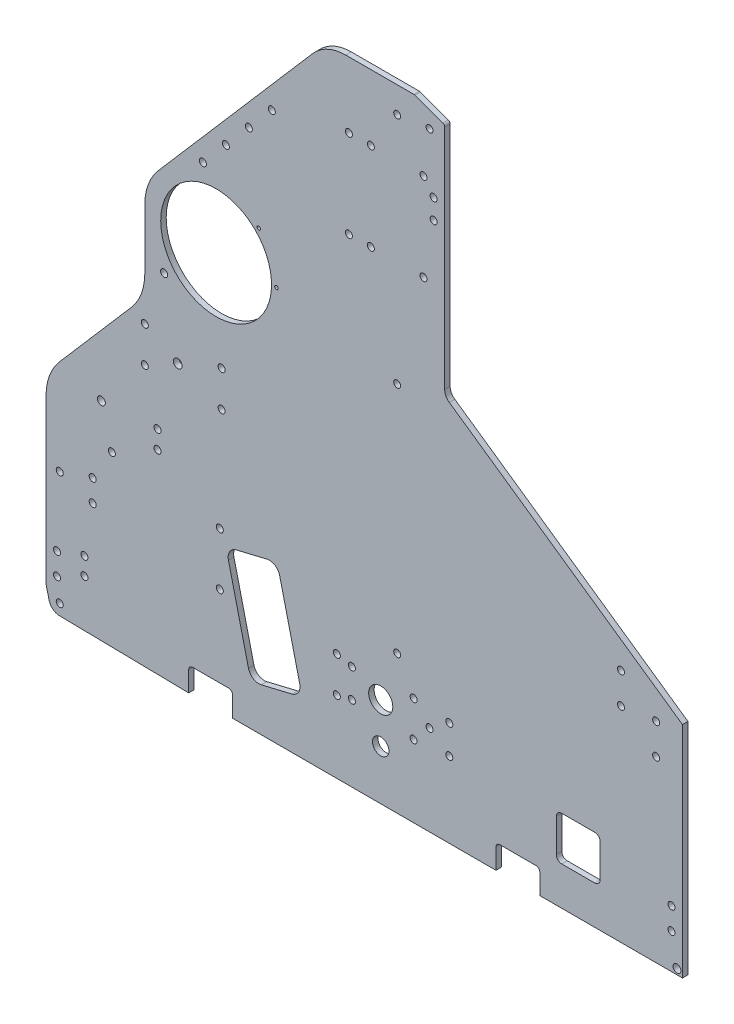
from build123d import *

# Parameters (mm, degrees)
SKETCH1_R           = 2.032
SKETCH1_R_2         = 2.54
SKETCH1_R_3         = 2
BOSS_EXTRUDE1_DEPTH = 3.175
FILLET1_R           = 2.286
FILLET2_R           = 6.35
SKETCH2_R           = 2.032
CUT_EXTRUDE1_DEPTH  = 505.524983177
FILLET3_R           = 1.5875
SKETCH3_R           = 2.032
SKETCH3_R_2         = 2.286
SKETCH3_R_3         = 1.016
CUT_EXTRUDE2_DEPTH  = 505.524983177
SKETCH4_R           = 2.032
SKETCH4_R_2         = 6.985
SKETCH4_R_3         = 4.7625
CUT_EXTRUDE3_DEPTH  = 505.524983177
SKETCH5_R           = 32.0675
SKETCH5_R_2         = 2.286000001
CUT_EXTRUDE5_DEPTH  = 540.282512256
FILLET4_R           = 31.75
CUT_EXTRUDE6_DEPTH  = 505.524983177
FILLET5_R           = 25.4
SKETCH8_R           = 2.032
CUT_EXTRUDE7_DEPTH  = 505.524983177


with BuildPart() as part:
    # Sketch1 → Boss-Extrude1 (new body)
    with BuildSketch(Plane.XY):
        with BuildLine():
            Line((7.829508682, -19.049081656), (82.55, -20.32))
            Line((82.55, -20.32), (82.55, -6.35))
            Line((82.55, -6.35), (107.95, -6.35))
            Line((107.95, -6.35), (107.95, -20.32))
            Line((107.95, -20.32), (260.35, -20.32))
            Line((260.35, -20.32), (260.35, -6.35))
            Line((260.35, -6.35), (285.75, -6.35))
            Line((285.75, -6.35), (285.75, -20.32))
            Line((285.75, -20.32), (368.3, -20.32))
            Line((368.3, -20.32), (368.3, 106.68))
            Line((368.3, 106.68), (230.66375, 202.565))
            Line((230.66375, 202.565), (230.66375, 338.455))
            Line((230.66375, 338.455), (213.19998, 344.805))
            Line((213.19998, 344.805), (203.2, 344.805))
            Line((203.2, 344.805), (161.925, 344.805))
            Line((161.925, 344.805), (52.720122664, 218.469945827))
            ThreePointArc((52.720122664, 218.469945827), (52.803835479, 218.142145922), (52.832, 217.805))
            ThreePointArc((52.832, 217.805), (52.095493096, 216.239521914), (50.419872403, 215.808871996))
            Line((50.419872403, 215.808871996), (0, 157.48))
            Line((0, 157.48), (0, 0))
            Line((0, 0), (0, -6.35))
            ThreePointArc((0, -6.35), (0.047577015, -7.125863724), (0.189595124, -7.890101219))
            Line((0.189595124, -7.890101219), (1.777095124, -14.240101219))
            ThreePointArc((1.777095124, -14.240101219), (3.987212552, -17.671692778), (7.829508682, -19.049081656))
        make_face()
        with Locations((7.9375, -12.7)):
            Circle(SKETCH1_R, mode=Mode.SUBTRACT)
        with Locations((6.35, 0)):
            Circle(SKETCH1_R, mode=Mode.SUBTRACT)
        with Locations((6.35, 12.7)):
            Circle(SKETCH1_R, mode=Mode.SUBTRACT)
        with Locations((38.1, 78.105)):
            Circle(SKETCH1_R, mode=Mode.SUBTRACT)
        with Locations((57.15, 131.28625)):
            Circle(SKETCH1_R, mode=Mode.SUBTRACT)
        with Locations((57.15, 151.92375)):
            Circle(SKETCH1_R, mode=Mode.SUBTRACT)
        with Locations((76.2, 141.605)):
            Circle(SKETCH1_R_2, mode=Mode.SUBTRACT)
        with Locations((101.6, 131.28625)):
            Circle(SKETCH1_R, mode=Mode.SUBTRACT)
        with Locations((101.6, 151.92375)):
            Circle(SKETCH1_R, mode=Mode.SUBTRACT)
        with Locations((203.2, 59.805)):
            Circle(SKETCH1_R_3, mode=Mode.SUBTRACT)
        with Locations((361.95, 0)):
            Circle(SKETCH1_R, mode=Mode.SUBTRACT)
        with Locations((361.95, 12.7)):
            Circle(SKETCH1_R, mode=Mode.SUBTRACT)
        with Locations((353.06, 82.955052336)):
            Circle(SKETCH1_R, mode=Mode.SUBTRACT)
        with Locations((332.74, 98.195052336)):
            Circle(SKETCH1_R, mode=Mode.SUBTRACT)
        with Locations((332.74, 115.975052336)):
            Circle(SKETCH1_R, mode=Mode.SUBTRACT)
        with Locations((353.06, 100.735052336)):
            Circle(SKETCH1_R, mode=Mode.SUBTRACT)
        with Locations((68.326, 182.923674932)):
            Circle(SKETCH1_R, mode=Mode.SUBTRACT)
        with Locations((76.2, 217.805)):
            Circle(SKETCH1_R, mode=Mode.SUBTRACT)
        with Locations((90.779500502, 249.682)):
            Circle(SKETCH1_R, mode=Mode.SUBTRACT)
        with Locations((104.067838673, 265.054783374)):
            Circle(SKETCH1_R, mode=Mode.SUBTRACT)
        with Locations((117.356176844, 280.427566748)):
            Circle(SKETCH1_R, mode=Mode.SUBTRACT)
        with Locations((130.644515014, 295.800350122)):
            Circle(SKETCH1_R, mode=Mode.SUBTRACT)
        with Locations((203.2, 194.805)):
            Circle(SKETCH1_R_3, mode=Mode.SUBTRACT)
        with Locations((224.31375, 287.401)):
            Circle(SKETCH1_R, mode=Mode.SUBTRACT)
        with Locations((224.31375, 298.831)):
            Circle(SKETCH1_R, mode=Mode.SUBTRACT)
        with Locations((203.2, 329.805)):
            Circle(SKETCH1_R_3, mode=Mode.SUBTRACT)
        with Locations((221.931865, 332.105)):
            Circle(SKETCH1_R_3, mode=Mode.SUBTRACT)
    extrude(amount=BOSS_EXTRUDE1_DEPTH)

    # Fillet1
    fillet1_edges = [part.edges().sort_by_distance(p)[0] for p in [
        (285.75, -6.35, 1.5875),
        (107.95, -6.35, 1.5875),
        (260.35, -6.35, 1.5875),
        (82.55, -6.35, 1.5875),
    ]]
    fillet(fillet1_edges, radius=FILLET1_R)

    # Fillet2
    fillet2_edges = [part.edges().sort_by_distance(p)[0] for p in [
        (230.66375, 202.565, 1.5875),
    ]]
    fillet(fillet2_edges, radius=FILLET2_R)

    # Sketch2 → Cut-Extrude1 (cut, through all)
    with BuildSketch(Plane(origin=(0, 0, 0), x_dir=(-1, 0, 0), z_dir=(0, 0, -1))):
        with Locations((-100.552770272, 71.086035298)):
            Circle(SKETCH2_R)
        with Locations((-100.552770272, 40.606035298)):
            Circle(SKETCH2_R)
        with Locations((-22.225, 18.202541089)):
            Circle(SKETCH2_R)
        with Locations((-22.225, 8.042541089)):
            Circle(SKETCH2_R)
    extrude(amount=-CUT_EXTRUDE1_DEPTH, mode=Mode.SUBTRACT)

    # Fillet3
    fillet3_edges = [part.edges().sort_by_distance(p)[0] for p in [
        (230.66375, 338.455, 1.5875),
        (213.19998, 344.805, 1.5875),
    ]]
    fillet(fillet3_edges, radius=FILLET3_R)

    # Sketch3 → Cut-Extrude2 (cut, through all)
    with BuildSketch(Plane.XY.offset(3.175)):
        with BuildLine():
            Line((127.789350211, 69.359774106), (110.090750339, 65.117184968))
            ThreePointArc((110.090750339, 65.117184968), (106.287939856, 62.356288953), (105.55119507, 57.715047577))
            Line((105.55119507, 57.715047577), (117.160037875, 9.287010566))
            ThreePointArc((117.160037875, 9.287010566), (119.92093389, 5.484200083), (124.562175266, 4.747455297))
            Line((124.562175266, 4.747455297), (142.260775137, 8.990044434))
            ThreePointArc((142.260775137, 8.990044434), (146.063585621, 11.75094045), (146.800330407, 16.392181825))
            Line((146.800330407, 16.392181825), (135.191487602, 64.820218836))
            ThreePointArc((135.191487602, 64.820218836), (132.430591586, 68.62302932), (127.789350211, 69.359774106))
        make_face()
        with Locations((26.987500002, 46.953113935)):
            Circle(SKETCH3_R)
        with Locations((26.987500002, 59.653113935)):
            Circle(SKETCH3_R)
        with Locations((7.937500002, 53.303113935)):
            Circle(SKETCH3_R)
        with Locations((32.030600738, 100.810868776)):
            Circle(SKETCH3_R_2)
        with Locations((64.525942114, 102.94048958)):
            Circle(SKETCH3_R)
        with Locations((64.525942114, 92.525786339)):
            Circle(SKETCH3_R)
        with Locations((133.35, 208.228121768)):
            Circle(SKETCH3_R_3)
        with Locations((123.120704333, 232.923826101)):
            Circle(SKETCH3_R_3)
    extrude(amount=-CUT_EXTRUDE2_DEPTH, mode=Mode.SUBTRACT)

    # Sketch4 → Cut-Extrude3 (cut, through all)
    with BuildSketch(Plane.XY.offset(3.175)):
        with Locations((168.275, 42.06875)):
            Circle(SKETCH4_R)
        with Locations((212.725, 42.06875)):
            Circle(SKETCH4_R)
        with Locations((212.725, 21.43125)):
            Circle(SKETCH4_R)
        with Locations((168.275, 21.43125)):
            Circle(SKETCH4_R)
        with Locations((193.675, 31.75)):
            Circle(SKETCH4_R_2)
        with Locations((177.00498, 40.0431)):
            Circle(SKETCH4_R)
        with Locations((177.00498, 23.4569)):
            Circle(SKETCH4_R)
        with Locations((193.675, 8.466666658)):
            Circle(SKETCH4_R_3)
        with Locations((221.931865, 31.75)):
            Circle(SKETCH4_R)
        with Locations((233.36123, 23.4569)):
            Circle(SKETCH4_R)
        with Locations((233.36123, 40.0431)):
            Circle(SKETCH4_R)
    extrude(amount=-CUT_EXTRUDE3_DEPTH, mode=Mode.SUBTRACT)

    # Sketch5 → Cut-Extrude5 (cut, through all)
    with BuildSketch(Plane(origin=(0, 0, -187.325), x_dir=(-1, 0, 0), z_dir=(0, 0, -1))):
        Polygon((0, 157.48), (-57.15, 223.594705882), (-57.15, 165.333696112), (0, 99.218990229), align=None)
        with Locations((-98.425, 208.228121768)):
            Circle(SKETCH5_R)
        with Locations((-365.124993903, -17.144956474)):
            Circle(SKETCH5_R_2)
    extrude(amount=-CUT_EXTRUDE5_DEPTH, mode=Mode.SUBTRACT)

    # Fillet4
    fillet4_edges = [part.edges().sort_by_distance(p)[0] for p in [
        (0, 99.218990229, 1.5875),
        (57.15, 165.333696112, 1.5875),
        (57.15, 223.594705882, 1.5875),
    ]]
    fillet(fillet4_edges, radius=FILLET4_R)

    # Sketch6 → Cut-Extrude6 (cut, through all)
    with BuildSketch(Plane.XY.offset(3.175)):
        with BuildLine():
            Line((298.45, 27.305), (317.5, 27.305))
            ThreePointArc((317.5, 27.305), (319.74506403, 26.37506403), (320.675, 24.13))
            Line((320.675, 24.13), (320.675, 5.08))
            ThreePointArc((320.675, 5.08), (319.74506403, 2.83493597), (317.5, 1.905))
            Line((317.5, 1.905), (298.45, 1.905))
            ThreePointArc((298.45, 1.905), (296.20493597, 2.83493597), (295.275, 5.08))
            Line((295.275, 5.08), (295.275, 24.13))
            ThreePointArc((295.275, 24.13), (296.20493597, 26.37506403), (298.45, 27.305))
        make_face()
    extrude(amount=-CUT_EXTRUDE6_DEPTH, mode=Mode.SUBTRACT)

    # Fillet5
    fillet5_edges = [part.edges().sort_by_distance(p)[0] for p in [
        (161.925, 344.805, 1.5875),
    ]]
    fillet(fillet5_edges, radius=FILLET5_R)

    # Sketch8 → Cut-Extrude7 (cut, through all)
    with BuildSketch(Plane(origin=(0, 0, 0), x_dir=(-1, 0, 0), z_dir=(0, 0, -1))):
        with Locations((-187.96, 306.705)):
            Circle(SKETCH8_R)
        with Locations((-175.26, 306.705)):
            Circle(SKETCH8_R)
        with Locations((-218.44, 306.705)):
            Circle(SKETCH8_R)
        with Locations((-218.44, 255.905)):
            Circle(SKETCH8_R)
        with Locations((-187.96, 255.905)):
            Circle(SKETCH8_R)
        with Locations((-175.26, 255.905)):
            Circle(SKETCH8_R)
    extrude(amount=-CUT_EXTRUDE7_DEPTH, mode=Mode.SUBTRACT)


solid = part.part
